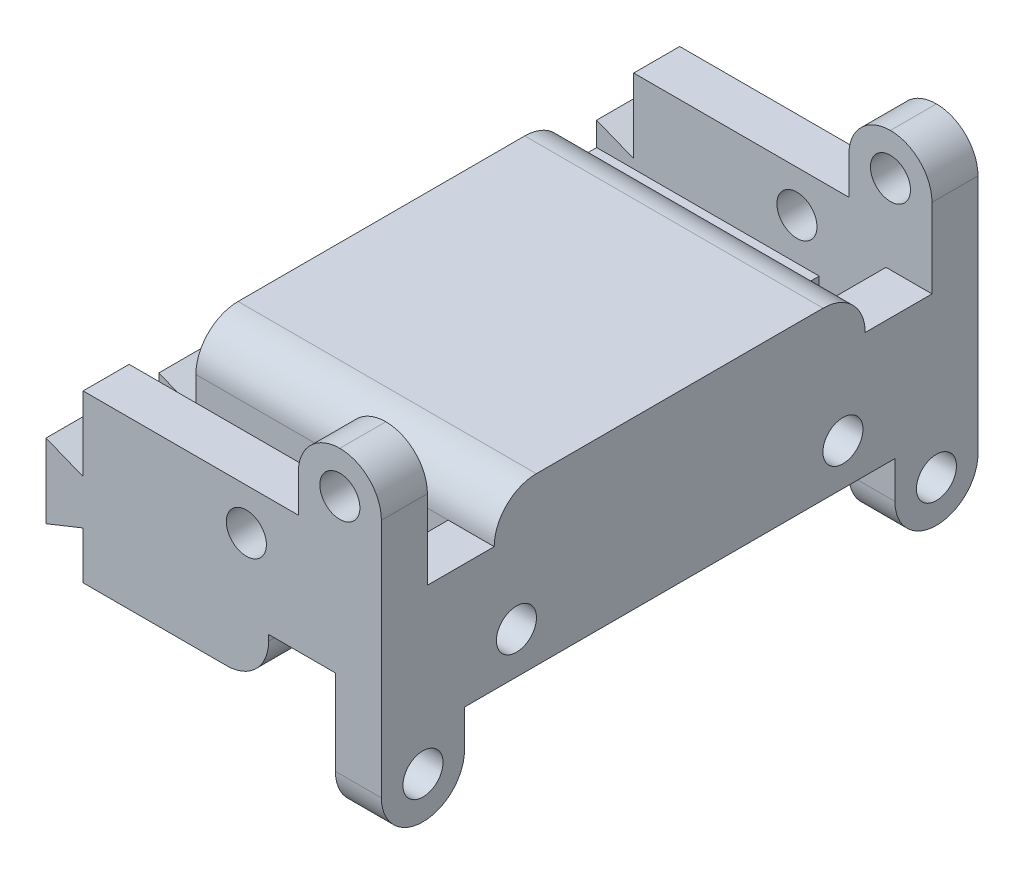
from build123d import *

# Parameters (mm, degrees)
ESBO_O1_R                  = 1.35
RESSALTO_EXTRUS_O1_DEPTH   = 2
ESBO_O3_W                  = 40.2
ESBO_O3_H                  = 2
RESSALTO_EXTRUS_O2_DEPTH   = 10.08
ESBO_O4_W                  = 3.1
ESBO_O4_H                  = 12.84
RESSALTO_EXTRUS_O3_DEPTH   = 34
CORTE_EXTRUS_O1_DEPTH      = 55.735280213
CORTE_EXTRUS_O1_DEPTH_BACK = 55.735280213
ESBO_O5_R                  = 1.35
ESBO_O7_W                  = 37.1
ESBO_O7_H                  = 3.24
CORTE_EXTRUS_O2_DEPTH      = 2
RESSALTO_EXTRUS_O5_START   = 2
ESBO_O12_R                 = 1.35
RESSALTO_EXTRUS_O5_DEPTH   = 2
ESBO_O18_W                 = 3.1
ESBO_O18_H                 = 3.24
RESSALTO_EXTRUS_O6_DEPTH   = 2
ESBO_O19_W                 = 3.1
ESBO_O19_H                 = 3.24
RESSALTO_EXTRUS_O7_DEPTH   = 2
ESBO_O21_R                 = 1.301764144
ESBO_O21_R_2               = 1.35
RESSALTO_EXTRUS_O8_DEPTH   = 1.1
RESSALTO_EXTRUS_O9_START   = 1.1
ESBO_O22_R                 = 1.35
RESSALTO_EXTRUS_O9_DEPTH   = 1.1
ESBO_O23_W                 = 3.1
ESBO_O23_H                 = 5.6
RESSALTO_EXTRUS_O10_DEPTH  = 5.85
CORTE_EXTRUS_O3_REACH      = 63.173
ESBO_O24_R                 = 1.35
ESBO_O25_W                 = 4.5
ESBO_O25_H                 = 3.1
CORTE_EXTRUS_O6_DEPTH      = 4.48
ESBO_O27_W                 = 3.1
ESBO_O27_H                 = 29
CORTE_EXTRUS_O7_DEPTH      = 4.48
ESBO_O28_W                 = 25
ESBO_O28_H                 = 40.2
CORTE_EXTRUS_O8_DEPTH      = 1.24
ESBO_O29_W                 = 25
ESBO_O29_H                 = 5.6
RESSALTO_EXTRUS_O11_DEPTH  = 34
ESBO_O31_W                 = 3.1
ESBO_O31_H                 = 25
RESSALTO_EXTRUS_O12_DEPTH  = 2.84
ESBO_O32_W                 = 25
ESBO_O32_H                 = 5.6
RESSALTO_EXTRUS_O13_DEPTH  = 34
FILETE1_R                  = 2.84
ESBO_O33_W                 = 5.6
ESBO_O33_H                 = 3.1
CORTE_EXTRUS_O9_DEPTH      = 0.55
ESBO_O35_W                 = 3.1
ESBO_O35_H                 = 5.6
CORTE_EXTRUS_O10_DEPTH     = 5.03
FILETE2_R                  = 2.8
DIVIDIR1_SURFACE_1_BACK    = 61.888
DIVIDIR1_SURFACE_1_DEPTH   = 123.776
DIVIDIR1_SURFACE_2_BACK    = 61.888
DIVIDIR1_SURFACE_2_DEPTH   = 123.776


# Read off the part's stored shape, not the designer's step: Corpo-Excluir/Manter 1
with BuildPart() as part:
    # Esboço1 → Ressalto-extrusão1 (new body)
    with BuildSketch(Plane.XY):
        Polygon((0, 0), (5.6, 0), (5.6, -5.85), (34.6, -5.85), (34.6, 0), (40.2, 0), (40.2, -11.45), (0, -11.45), align=None)
        with Locations((2.8, -3.35)):
            Circle(ESBO_O1_R, mode=Mode.SUBTRACT)
        with Locations((37.4, -3.35)):
            Circle(ESBO_O1_R, mode=Mode.SUBTRACT)
        with Locations((31.1, -8.65)):
            Circle(ESBO_O1_R, mode=Mode.SUBTRACT)
        with Locations((9.1, -8.65)):
            Circle(ESBO_O1_R, mode=Mode.SUBTRACT)
    extrude(amount=RESSALTO_EXTRUS_O1_DEPTH)

    # Esboço3 → Ressalto-extrusão2 (add)
    with BuildSketch(Plane.XZ.offset(11.45)):
        with Locations((20.1, 1)):
            Rectangle(ESBO_O3_W, ESBO_O3_H)
    extrude(amount=RESSALTO_EXTRUS_O2_DEPTH)

    # Esboço4 → Ressalto-extrusão3 (add)
    with BuildSketch(Plane(origin=(0, 0, 0), x_dir=(-1, 0, 0), z_dir=(0, 0, -1))):
        with Locations((-38.65, -15.11)):
            Rectangle(ESBO_O4_W, ESBO_O4_H)
        with Locations((-1.55, -15.11)):
            Rectangle(ESBO_O4_W, ESBO_O4_H)
    extrude(amount=RESSALTO_EXTRUS_O3_DEPTH)

    # Esboço5 → Corte-extrusão1 (cut, two sides: drawn at the far end of the back side and taken through both)
    with BuildSketch(Plane.ZY.offset(-37.1).offset(-CORTE_EXTRUS_O1_DEPTH_BACK)):
        with Locations((-6, -14.25)):
            Circle(ESBO_O5_R)
        with Locations((-28, -14.25)):
            Circle(ESBO_O5_R)
    extrude(amount=CORTE_EXTRUS_O1_DEPTH + CORTE_EXTRUS_O1_DEPTH_BACK, mode=Mode.SUBTRACT)

    # Esboço7 → Corte-extrusão2 (cut)
    with BuildSketch(Plane(origin=(0, 0, 0), x_dir=(-1, 0, 0), z_dir=(0, 0, -1))):
        with Locations((-18.55, -19.91)):
            Rectangle(ESBO_O7_W, ESBO_O7_H)
    extrude(amount=-CORTE_EXTRUS_O2_DEPTH, mode=Mode.SUBTRACT)

    # Esboço12 → Ressalto-extrusão5 (add)
    with BuildSketch(Plane(origin=(0, 0, -34), x_dir=(-1, 0, 0), z_dir=(0, 0, -1)).offset(RESSALTO_EXTRUS_O5_START)):
        Polygon((-5.6, 0), (0, 0), (0, -18.29), (-40.2, -18.29), (-40.2, 0), (-34.6, 0), (-34.6, -5.85), (-5.6, -5.85), align=None)
        with Locations(Location((-31.1, -8.65, 0), (0, 0, 180))):
            Circle(ESBO_O12_R, mode=Mode.SUBTRACT)
        with Locations(Location((-9.1, -8.65, 0), (0, 0, 180))):
            Circle(ESBO_O12_R, mode=Mode.SUBTRACT)
        with Locations(Location((-2.8, -3.35, 0), (0, 0, 180))):
            Circle(ESBO_O12_R, mode=Mode.SUBTRACT)
        with Locations(Location((-37.4, -3.35, 0), (0, 0, 180))):
            Circle(ESBO_O12_R, mode=Mode.SUBTRACT)
    extrude(amount=-RESSALTO_EXTRUS_O5_DEPTH)

    # Esboço18 → Ressalto-extrusão6 (add)
    with BuildSketch(Plane.XY):
        with Locations((1.55, -19.91)):
            Rectangle(ESBO_O18_W, ESBO_O18_H)
    extrude(amount=RESSALTO_EXTRUS_O6_DEPTH)

    # Esboço19 → Ressalto-extrusão7 (add)
    with BuildSketch(Plane(origin=(0, 0, -34), x_dir=(-1, 0, 0), z_dir=(0, 0, -1))):
        with Locations((-1.55, -19.91)):
            Rectangle(ESBO_O19_W, ESBO_O19_H)
        with Locations((-38.65, -19.91)):
            Rectangle(ESBO_O19_W, ESBO_O19_H)
    extrude(amount=RESSALTO_EXTRUS_O7_DEPTH)

    # Esboço21 → Ressalto-extrusão8 (add)
    with BuildSketch(Plane.XY.offset(2)):
        Polygon((37.1, -21.53), (40.2, -21.53), (40.2, 0), (34.6, 0), (34.6, -5.85), (5.6, -5.85), (5.6, 0), (0, 0), (0, -21.53), (3.1, -21.53), (3.1, -18.29), (37.1, -18.29), align=None)
        with Locations((2.8, -3.35)):
            Circle(ESBO_O21_R, mode=Mode.SUBTRACT)
        with Locations((9.1, -8.65)):
            Circle(ESBO_O21_R_2, mode=Mode.SUBTRACT)
        with Locations((31.1, -8.65)):
            Circle(ESBO_O21_R_2, mode=Mode.SUBTRACT)
        with Locations((37.4, -3.35)):
            Circle(ESBO_O21_R_2, mode=Mode.SUBTRACT)
    extrude(amount=RESSALTO_EXTRUS_O8_DEPTH)

    # Esboço22 → Ressalto-extrusão9 (add)
    with BuildSketch(Plane(origin=(0, 0, -36), x_dir=(-1, 0, 0), z_dir=(0, 0, -1)).offset(RESSALTO_EXTRUS_O9_START)):
        Polygon((-5.6, 0), (0, 0), (0, -21.53), (-3.1, -21.53), (-3.1, -18.29), (-37.1, -18.29), (-37.1, -21.53), (-40.2, -21.53), (-40.2, 0), (-34.6, 0), (-34.6, -5.85), (-5.6, -5.85), align=None)
        with Locations(Location((-37.4, -3.35, 0), (0, 0, 180))):
            Circle(ESBO_O22_R, mode=Mode.SUBTRACT)
        with Locations(Location((-31.1, -8.65, 0), (0, 0, 180))):
            Circle(ESBO_O22_R, mode=Mode.SUBTRACT)
        with Locations(Location((-9.1, -8.65, 0), (0, 0, 180))):
            Circle(ESBO_O22_R, mode=Mode.SUBTRACT)
        with Locations(Location((-2.8, -3.35, 0), (0, 0, 180))):
            Circle(ESBO_O22_R, mode=Mode.SUBTRACT)
    extrude(amount=-RESSALTO_EXTRUS_O9_DEPTH)

    # Esboço23 → Ressalto-extrusão10 (add)
    with BuildSketch(Plane.XZ.offset(21.53)):
        with Locations((1.55, 0.3)):
            Rectangle(ESBO_O23_W, ESBO_O23_H)
        with Locations((1.55, -34.3)):
            Rectangle(ESBO_O23_W, ESBO_O23_H)
        with Locations((38.65, -34.3)):
            Rectangle(ESBO_O23_W, ESBO_O23_H)
        with Locations((38.65, 0.3)):
            Rectangle(ESBO_O23_W, ESBO_O23_H)
    extrude(amount=RESSALTO_EXTRUS_O10_DEPTH)

    # Corte-extrusão3: up to this face of the body (flat: up to its plane)
    corte_extrus_o3_end = Plane(part.part.faces().sort_by_distance((40.2, -15.177512698, -17))[0])
    # Esboço24 → Corte-extrusão3 (cut, up to the picked face)
    with BuildSketch(Plane.ZY, mode=Mode.PRIVATE) as corte_extrus_o3_sk1:
        with Locations(Location((-34.3, -19.55, 0), (0, 0, 270))):
            Circle(ESBO_O24_R)
    corte_extrus_o3_tool1 = split(extrude(corte_extrus_o3_sk1.sketch, amount=-CORTE_EXTRUS_O3_REACH, mode=Mode.PRIVATE), bisect_by=corte_extrus_o3_end, keep=Keep.BOTH, mode=Mode.PRIVATE)
    # Esboço24 → Corte-extrusão3 (cut, up to the picked face)
    with BuildSketch(Plane.ZY, mode=Mode.PRIVATE) as corte_extrus_o3_sk2:
        with Locations(Location((0.3, -19.55, 0), (0, 0, 270))):
            Circle(ESBO_O24_R)
    corte_extrus_o3_tool2 = split(extrude(corte_extrus_o3_sk2.sketch, amount=-CORTE_EXTRUS_O3_REACH, mode=Mode.PRIVATE), bisect_by=corte_extrus_o3_end, keep=Keep.BOTH, mode=Mode.PRIVATE)
    add(corte_extrus_o3_tool1.solids().sort_by(Axis((0, -19.55, -34.3), (1, 0, 0)))[0], mode=Mode.SUBTRACT)
    add(corte_extrus_o3_tool2.solids().sort_by(Axis((0, -19.55, 0.3), (1, 0, 0)))[0], mode=Mode.SUBTRACT)

    # Esboço25 → Corte-extrusão6 (cut)
    with BuildSketch(Plane.XZ.offset(18.29)):
        with Locations((5.35, -35.55)):
            Rectangle(ESBO_O25_W, ESBO_O25_H)
        with Locations((34.85, -35.55)):
            Rectangle(ESBO_O25_W, ESBO_O25_H)
        with Locations((34.85, 1.55)):
            Rectangle(ESBO_O25_W, ESBO_O25_H)
        with Locations((5.35, 1.55)):
            Rectangle(ESBO_O25_W, ESBO_O25_H)
    extrude(amount=-CORTE_EXTRUS_O6_DEPTH, mode=Mode.SUBTRACT)

    # Esboço27 → Corte-extrusão7 (cut)
    with BuildSketch(Plane.XZ.offset(21.53)):
        with Locations((1.55, -17)):
            Rectangle(ESBO_O27_W, ESBO_O27_H)
        with Locations((38.65, -17)):
            Rectangle(ESBO_O27_W, ESBO_O27_H)
    extrude(amount=-CORTE_EXTRUS_O7_DEPTH, mode=Mode.SUBTRACT)

    # Esboço28 → Corte-extrusão8 (cut)
    with BuildSketch(Plane.XZ.offset(18.29)):
        with Locations((20.1, -17)):
            Rectangle(ESBO_O28_W, ESBO_O28_H)
    extrude(amount=-CORTE_EXTRUS_O8_DEPTH, mode=Mode.SUBTRACT)

    # Esboço29 → Ressalto-extrusão11 (add)
    with BuildSketch(Plane.XY.offset(-34)):
        with Locations((20.1, -14.25)):
            Rectangle(ESBO_O29_W, ESBO_O29_H)
    extrude(amount=RESSALTO_EXTRUS_O11_DEPTH)

    # Esboço31 → Ressalto-extrusão12 (add)
    with BuildSketch(Plane(origin=(0, -8.69, 0), x_dir=(1, 0, 0), z_dir=(0, 1, 0))):
        with Locations((1.55, 17)):
            Rectangle(ESBO_O31_W, ESBO_O31_H)
        with Locations((38.65, 17)):
            Rectangle(ESBO_O31_W, ESBO_O31_H)
    extrude(amount=RESSALTO_EXTRUS_O12_DEPTH)

    # Esboço32 → Ressalto-extrusão13 (add)
    with BuildSketch(Plane.ZY.offset(-37.1)):
        with Locations((-17, -8.65)):
            Rectangle(ESBO_O32_W, ESBO_O32_H)
    extrude(amount=RESSALTO_EXTRUS_O13_DEPTH)

    # Filete1
    filete1_edges = [part.edges().sort_by_distance(p)[0] for p in [
        (32.6, -17.05, -17),
        (7.6, -17.05, -17),
        (20.1, -5.85, -29.5),
        (20.1, -5.85, -4.5),
    ]]
    fillet(filete1_edges, radius=FILETE1_R)

    # Esboço33 → Corte-extrusão9 (cut)
    with BuildSketch(Plane(origin=(0, 0, 0), x_dir=(1, 0, 0), z_dir=(0, 1, 0))):
        with Locations((2.8, 35.55)):
            Rectangle(ESBO_O33_W, ESBO_O33_H)
        with Locations((37.4, 35.55)):
            Rectangle(ESBO_O33_W, ESBO_O33_H)
        with Locations((37.4, -1.55)):
            Rectangle(ESBO_O33_W, ESBO_O33_H)
        with Locations((2.8, -1.55)):
            Rectangle(ESBO_O33_W, ESBO_O33_H)
    extrude(amount=-CORTE_EXTRUS_O9_DEPTH, mode=Mode.SUBTRACT)

    # Esboço35 → Corte-extrusão10 (cut)
    with BuildSketch(Plane.XZ.offset(27.38)):
        with Locations((1.55, 0.3)):
            Rectangle(ESBO_O35_W, ESBO_O35_H)
        with Locations((38.65, 0.3)):
            Rectangle(ESBO_O35_W, ESBO_O35_H)
        with Locations((38.65, -34.3)):
            Rectangle(ESBO_O35_W, ESBO_O35_H)
        with Locations((1.55, -34.3)):
            Rectangle(ESBO_O35_W, ESBO_O35_H)
    extrude(amount=-CORTE_EXTRUS_O10_DEPTH, mode=Mode.SUBTRACT)

    # Filete2
    filete2_edges = [part.edges().sort_by_distance(p)[0] for p in [
        (34.6, -0.55, 1.55),
        (40.2, -0.55, 1.55),
        (0, -0.55, 1.55),
        (5.6, -0.55, 1.55),
        (40.2, -0.55, -35.55),
        (34.6, -0.55, -35.55),
        (5.6, -0.55, -35.55),
        (0, -0.55, -35.55),
        (1.55, -22.35, -31.5),
        (1.55, -22.35, -37.1),
        (38.65, -22.35, -31.5),
        (38.65, -22.35, -37.1),
        (38.65, -22.35, 3.1),
        (38.65, -22.35, -2.5),
        (1.55, -22.35, -2.5),
        (1.55, -22.35, 3.1),
    ]]
    fillet(filete2_edges, radius=FILETE2_R - 0.0001)  # a hair under: the kernel refuses the full size


with BuildPart() as body_2:
    # Dividir1: the piece behind the surface
    add(part.part)
    # Dividir1 surface: a surface, the sketch's curves swept straight by 123.776 mm
    with BuildLine(Plane.XY.offset(3.1).offset(-DIVIDIR1_SURFACE_1_BACK), mode=Mode.PRIVATE) as dividir1_surface_1_path:
        Line((20.1, -0.55), (20.1, -10.85))
        Line((20.1, -10.85), (17.6, -9.85))
        Line((17.6, -9.85), (17.6, -14.85))
        Line((17.6, -14.85), (20.1, -13.85))
        Line((20.1, -13.85), (20.1, -22.35))
    dividir1_surface_1 = Shell.extrude(dividir1_surface_1_path.wire(), (0 * DIVIDIR1_SURFACE_1_DEPTH, 0 * DIVIDIR1_SURFACE_1_DEPTH, 1 * DIVIDIR1_SURFACE_1_DEPTH))
    split(bisect_by=dividir1_surface_1, keep=Keep.BOTTOM)


with BuildPart() as part_1:
    add(part.part)

    # Dividir1: split by a surface, the side it looks to stays
    # Dividir1 surface: a surface, the sketch's curves swept straight by 123.776 mm
    with BuildLine(Plane.XY.offset(3.1).offset(-DIVIDIR1_SURFACE_2_BACK), mode=Mode.PRIVATE) as dividir1_surface_2_path:
        Line((20.1, -0.55), (20.1, -10.85))
        Line((20.1, -10.85), (17.6, -9.85))
        Line((17.6, -9.85), (17.6, -14.85))
        Line((17.6, -14.85), (20.1, -13.85))
        Line((20.1, -13.85), (20.1, -22.35))
    dividir1_surface_2 = Shell.extrude(dividir1_surface_2_path.wire(), (0 * DIVIDIR1_SURFACE_2_DEPTH, 0 * DIVIDIR1_SURFACE_2_DEPTH, 1 * DIVIDIR1_SURFACE_2_DEPTH))
    split(bisect_by=dividir1_surface_2, keep=Keep.TOP)


solid = part_1.part
